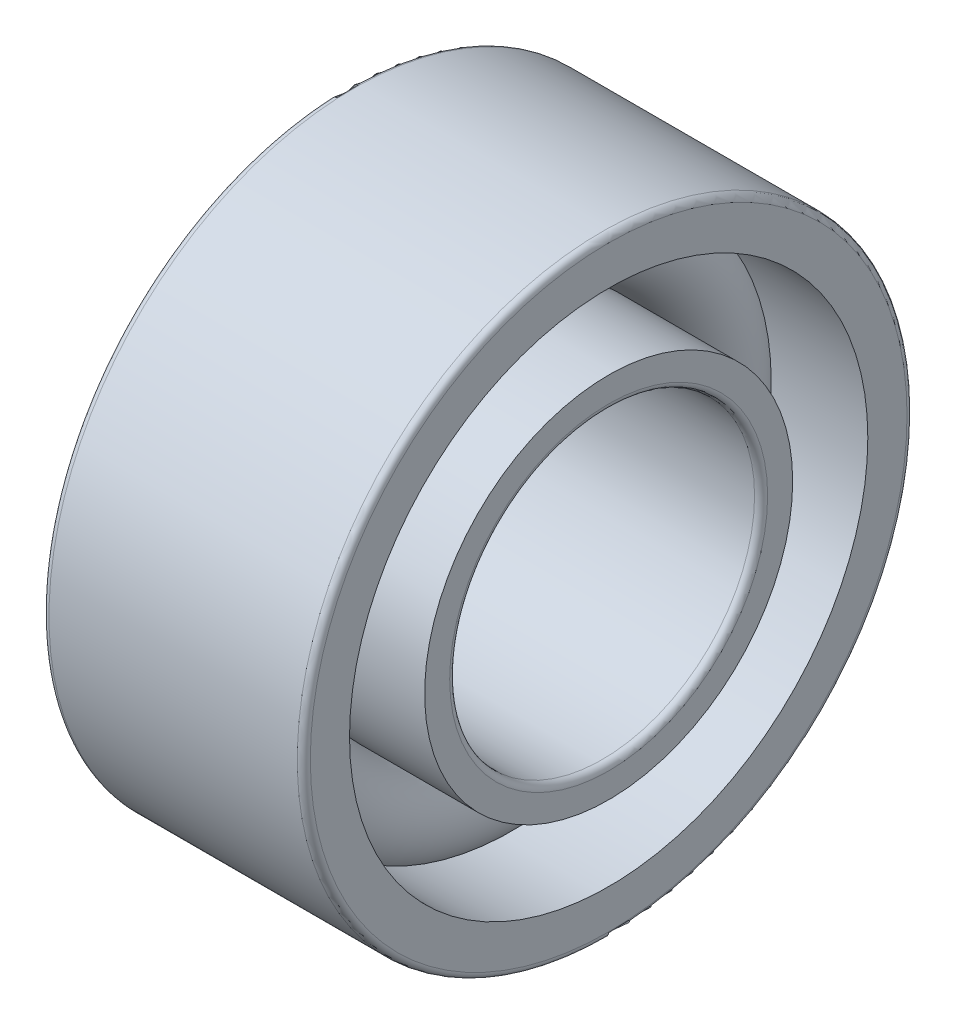
from build123d import *

# Parameters (mm, degrees)
CAGSPISKE_W     = 0.525
CAGSPISKE_H     = 0.35
CAGESPINE_ANGLE = 0.001
BALSIMSKE_R     = 1.05


with BuildPart() as part:
    # CagSpiSke → CageSpine (revolve)
    with BuildSketch(Plane.XY):
        with Locations((0, 5.25)):
            Rectangle(CAGSPISKE_W, CAGSPISKE_H)
    revolve(axis=Axis((-20.6375, 0, 0), (1, 0, 0)), revolution_arc=CAGESPINE_ANGLE)

    # BalSimSke → BallsSimplified (revolve)
    with BuildSketch(Plane.XY):
        with Locations((0, 5.25)):
            Circle(BALSIMSKE_R)
    revolve(axis=Axis((-10, 0, 0), (1, 0, 0)))

    # InnRacSke → InnerRace (revolve)
    with BuildSketch(Plane.XY):
        with BuildLine():
            Line((-0.748748957, 4.55), (-3, 4.55))
            Line((-3, 4.55), (-3, 3.65))
            ThreePointArc((-3, 3.65), (-2.956066017, 3.543933983), (-2.85, 3.5))
            Line((-2.85, 3.5), (2.85, 3.5))
            ThreePointArc((2.85, 3.5), (2.956066017, 3.543933983), (3, 3.65))
            Line((3, 3.65), (3, 4.225))
            Line((3, 4.225), (0, 4.225))
            ThreePointArc((0, 4.225), (-0.408120693, 4.309754022), (-0.748748957, 4.55))
        make_face()
    revolve(axis=Axis((-20.6375, 0, 0), (1, 0, 0)))

    # OutRacSke → OuterRace (revolve)
    with BuildSketch(Plane.XY):
        with BuildLine():
            Line((0, 6.275), (-3, 6.275))
            Line((-3, 6.275), (-3, 6.85))
            ThreePointArc((-3, 6.85), (-2.956066017, 6.956066017), (-2.85, 7))
            Line((-2.85, 7), (2.85, 7))
            ThreePointArc((2.85, 7), (2.956066017, 6.956066017), (3, 6.85))
            Line((3, 6.85), (3, 5.95))
            Line((3, 5.95), (0.748748957, 5.95))
            ThreePointArc((0.748748957, 5.95), (0.408120693, 6.190245978), (0, 6.275))
        make_face()
    revolve(axis=Axis((-20.6375, 0, 0), (1, 0, 0)))


solid = part.part
